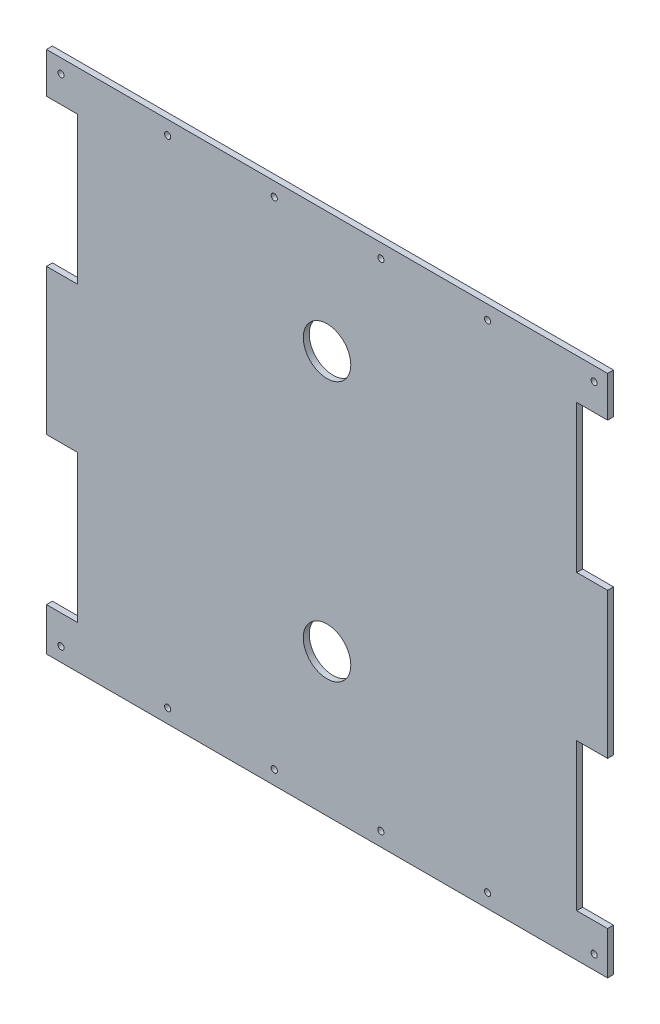
from build123d import *

# Parameters (mm, degrees)
SKETCH5_R           = 1.65
SKETCH5_R_2         = 12.7
BOSS_EXTRUDE1_DEPTH = 3.175


with BuildPart() as part:
    # Sketch5 → Boss-Extrude1 (new body)
    with BuildSketch(Plane.XY):
        Polygon((47.124604737, -7.452255775), (30.614604737, -7.452255775), (30.614604737, 71.287744225), (47.124604737, 71.287744225), (47.124604737, 149.14592508), (30.614604737, 149.14592508), (30.614604737, 227.88592508), (47.124604737, 227.88592508), (47.124604737, 249.558730102), (-252.849395263, 249.558730102), (-252.849395263, 227.88592508), (-236.339395263, 227.88592508), (-236.339395263, 149.14592508), (-252.849395263, 149.14592508), (-252.849395263, 71.287744225), (-236.339395263, 71.287744225), (-236.339395263, -7.452255775), (-252.849395263, -7.452255775), (-252.849395263, -30.349269898), (47.124604737, -30.349269898), align=None)
        with Locations((39.94351791, -22.890690042)):
            Circle(SKETCH5_R, mode=Mode.SUBTRACT)
        with Locations((-17.05648209, -22.890690042)):
            Circle(SKETCH5_R, mode=Mode.SUBTRACT)
        with Locations((-74.05648209, -22.890690042)):
            Circle(SKETCH5_R, mode=Mode.SUBTRACT)
        with Locations((-131.05648209, -22.890690042)):
            Circle(SKETCH5_R, mode=Mode.SUBTRACT)
        with Locations((-188.05648209, -22.890690042)):
            Circle(SKETCH5_R, mode=Mode.SUBTRACT)
        with Locations((-245.05648209, -22.890690042)):
            Circle(SKETCH5_R, mode=Mode.SUBTRACT)
        with Locations((39.94351791, 242.101620414)):
            Circle(SKETCH5_R, mode=Mode.SUBTRACT)
        with Locations((-17.05648209, 242.101620414)):
            Circle(SKETCH5_R, mode=Mode.SUBTRACT)
        with Locations((-74.05648209, 242.101620414)):
            Circle(SKETCH5_R, mode=Mode.SUBTRACT)
        with Locations((-131.05648209, 242.101620414)):
            Circle(SKETCH5_R, mode=Mode.SUBTRACT)
        with Locations((-188.05648209, 242.101620414)):
            Circle(SKETCH5_R, mode=Mode.SUBTRACT)
        with Locations((-245.05648209, 242.101620414)):
            Circle(SKETCH5_R, mode=Mode.SUBTRACT)
        with Locations((-102.862395263, 184.854342805)):
            Circle(SKETCH5_R_2, mode=Mode.SUBTRACT)
        with Locations((-102.862395263, 45.850730102)):
            Circle(SKETCH5_R_2, mode=Mode.SUBTRACT)
    extrude(amount=BOSS_EXTRUDE1_DEPTH)


solid = part.part
